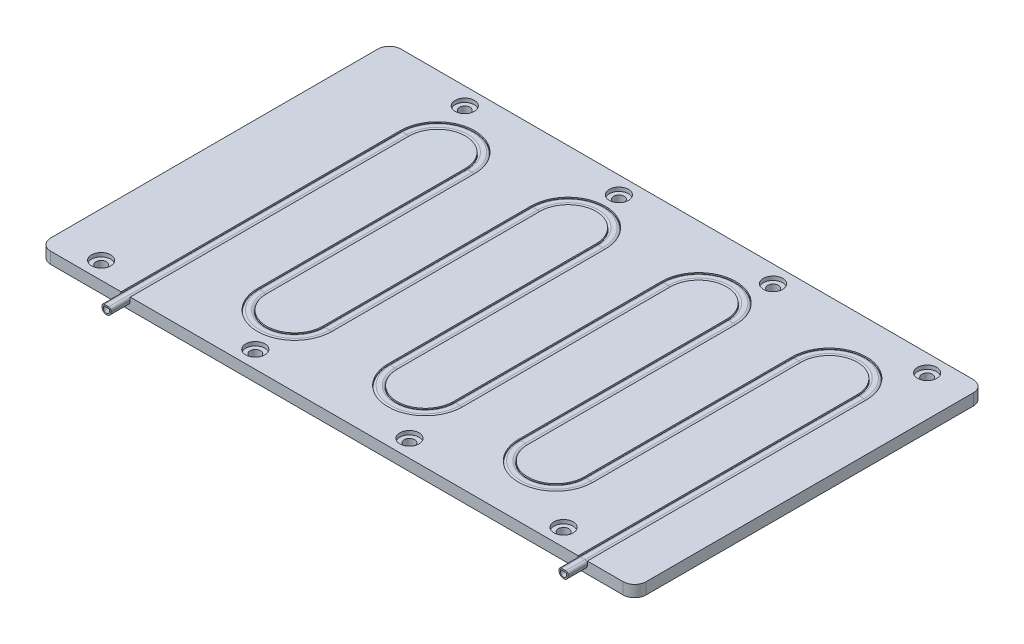
from build123d import *

# Parameters (mm, degrees)
SKETCH1_W           = 310
SKETCH1_H           = 182.3
BOSS_EXTRUDE1_DEPTH = 6
HOLE1_D             = 5.5
HOLE1_DEPTH         = 6
HOLE1_CBORE_D       = 10
HOLE1_CBORE_DEPTH   = 2
HOLE1_TIP           = 1.652366702
FILLET1_R           = 6


with BuildPart() as part:
    # Sketch1 → Boss-Extrude1 (new body)
    with BuildSketch(Plane(origin=(0, 0, 0), x_dir=(1, 0, 0), z_dir=(0, 1, 0))):
        Rectangle(SKETCH1_W, SKETCH1_H)
    extrude(amount=BOSS_EXTRUDE1_DEPTH)

    # Hole1
    with Locations(Plane(origin=(0, 6, 0), x_dir=(1, 0, 0), z_dir=(0, 1, 0))):
        with Locations((-131.75, -82.15), (-106.75, 82.15), (-26.5, 82.15), (53.75, 82.15), (134, 82.15), (-51.5, -82.15), (28.75, -82.15), (109, -82.15)):
            CounterBoreHole(HOLE1_D / 2, HOLE1_CBORE_D / 2, HOLE1_CBORE_DEPTH, depth=HOLE1_DEPTH)
            with Locations((0, 0, -(HOLE1_DEPTH + HOLE1_TIP / 2))):  # 118° drill point
                Cone(0, HOLE1_D / 2, HOLE1_TIP, mode=Mode.SUBTRACT)

    # Fillet1
    fillet1_edges = [part.edges().sort_by_distance(p)[0] for p in [
        (155, 3, -91.15),
        (155, 3, 91.15),
        (-155, 3, -91.15),
        (-155, 3, 91.15),
    ]]
    fillet(fillet1_edges, radius=FILLET1_R)

    # Cut-Sweep1: sweep along a path in Sketch6
    with BuildLine(Plane(origin=(0, 6, 0), x_dir=(1, 0, 0), z_dir=(0, 1, 0))) as cut_sweep1_path:
        Line((128, -101.15), (128, -91.15))
        Line((128, -91.15), (128, 54.15))
        ThreePointArc((128, 54.15), (111, 71.15), (94, 54.15))
        Line((94, 54.15), (94, -54.15))
        ThreePointArc((94, -54.15), (77, -71.15), (60, -54.15))
        Line((60, -54.15), (60, 54.15))
        ThreePointArc((60, 54.15), (43, 71.15), (26, 54.15))
        Line((26, 54.15), (26, -54.15))
        ThreePointArc((26, -54.15), (9, -71.15), (-8, -54.15))
        Line((-8, -54.15), (-8, 54.15))
        ThreePointArc((-8, 54.15), (-25, 71.15), (-42, 54.15))
        Line((-42, 54.15), (-42, -54.15))
        ThreePointArc((-42, -54.15), (-59, -71.15), (-76, -54.15))
        Line((-76, -54.15), (-76, 54.15))
        ThreePointArc((-76, 54.15), (-93, 71.15), (-110, 54.15))
        Line((-110, 54.15), (-110, -91.15))
        Line((-110, -91.15), (-110, -101.15))
    # Sketch7 → Cut-Sweep1 (sweep, cut)
    with BuildSketch(Plane.XY.offset(91.15)):
        with BuildLine():
            Line((-112.38125, 4.2), (-112.38125, 6))
            Line((-112.38125, 6), (-107.61875, 6))
            Line((-107.61875, 6), (-107.61875, 4.2))
            ThreePointArc((-107.61875, 4.2), (-110, 1.81875), (-112.38125, 4.2))
        make_face()
    sweep(path=cut_sweep1_path.line, mode=Mode.SUBTRACT)


with BuildPart() as body_2:
    # Sweep1: sweep along a path in Sketch6<2>
    with BuildLine(Plane(origin=(0, 6, 0), x_dir=(1, 0, 0), z_dir=(0, 1, 0))) as sweep1_path:
        Line((128, -101.15), (128, -91.15))
        Line((128, -91.15), (128, 54.15))
        ThreePointArc((128, 54.15), (111, 71.15), (94, 54.15))
        Line((94, 54.15), (94, -54.15))
        ThreePointArc((94, -54.15), (77, -71.15), (60, -54.15))
        Line((60, -54.15), (60, 54.15))
        ThreePointArc((60, 54.15), (43, 71.15), (26, 54.15))
        Line((26, 54.15), (26, -54.15))
        ThreePointArc((26, -54.15), (9, -71.15), (-8, -54.15))
        Line((-8, -54.15), (-8, 54.15))
        ThreePointArc((-8, 54.15), (-25, 71.15), (-42, 54.15))
        Line((-42, 54.15), (-42, -54.15))
        ThreePointArc((-42, -54.15), (-59, -71.15), (-76, -54.15))
        Line((-76, -54.15), (-76, 54.15))
        ThreePointArc((-76, 54.15), (-93, 71.15), (-110, 54.15))
        Line((-110, 54.15), (-110, -91.15))
        Line((-110, -91.15), (-110, -101.15))
    # Sketch8 → Sweep1 (sweep)
    with BuildSketch(Plane.XY.offset(91.15)):
        with BuildLine():
            Line((-112.38125, 4.2), (-112.38125, 4.75))
            ThreePointArc((-112.38125, 4.75), (-112.015133476, 5.633883476), (-111.13125, 6))
            Line((-111.13125, 6), (-108.86875, 6))
            ThreePointArc((-108.86875, 6), (-107.984866524, 5.633883476), (-107.61875, 4.75))
            Line((-107.61875, 4.75), (-107.61875, 4.2))
            ThreePointArc((-107.61875, 4.2), (-110, 1.81875), (-112.38125, 4.2))
        make_face()
        with BuildLine():
            Line((-111.61925, 4.2), (-111.61925, 4.838))
            ThreePointArc((-111.61925, 4.838), (-111.502092712, 5.120842712), (-111.21925, 5.238))
            Line((-111.21925, 5.238), (-108.78075, 5.238))
            ThreePointArc((-108.78075, 5.238), (-108.497907288, 5.120842712), (-108.38075, 4.838))
            Line((-108.38075, 4.838), (-108.38075, 4.2))
            ThreePointArc((-108.38075, 4.2), (-110, 2.58075), (-111.61925, 4.2))
        make_face(mode=Mode.SUBTRACT)
    sweep(path=sweep1_path.line)


solid = Compound([part.part, body_2.part])
